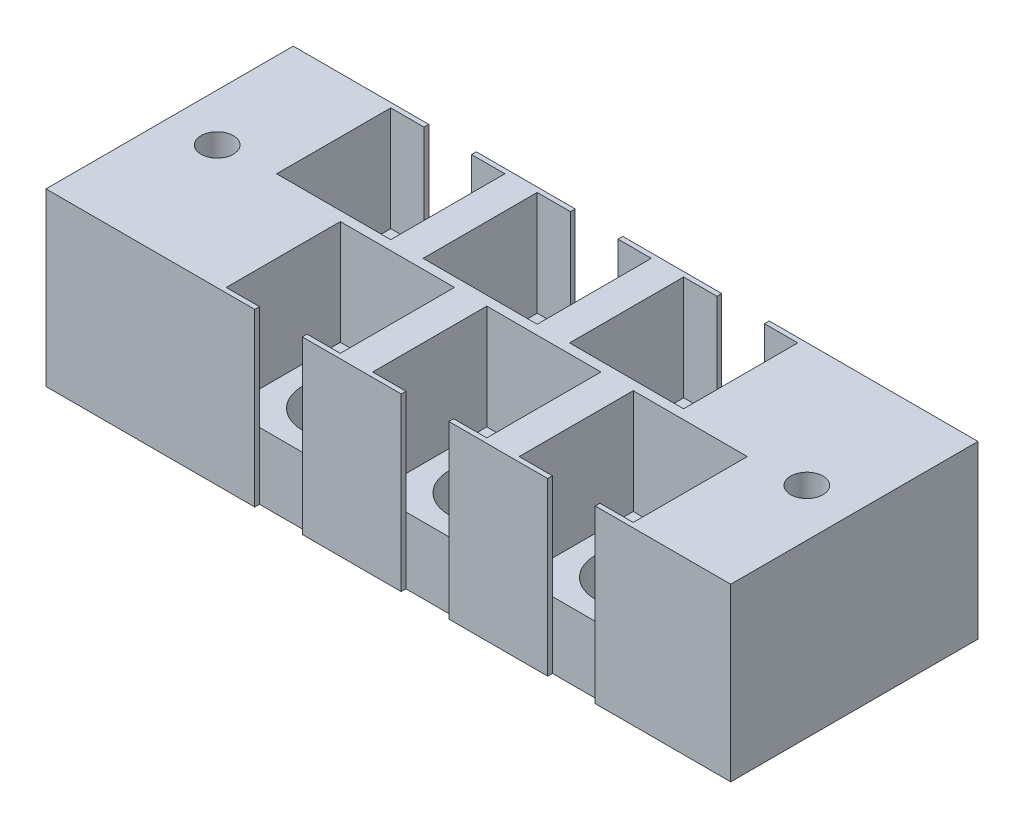
from build123d import *

# Parameters (mm, degrees)
SKETCH1_R               = 4
BOSS_EXTRUDE1_DEPTH     = 7
BOSS_EXTRUDE1_2_DEPTH   = 7
BOSS_EXTRUDE1_3_DEPTH   = 7
BOSS_EXTRUDE1_4_DEPTH   = 7
BOSS_EXTRUDE1_5_DEPTH   = 7
BOSS_EXTRUDE1_6_DEPTH   = 7
BOSS_EXTRUDE2_OUTLINE_R = 1.700000005
BOSS_EXTRUDE2_DEPTH     = 18
SKETCH2_W               = 2.2
SKETCH2_H               = 5.00000001
BOSS_EXTRUDE3_DEPTH     = 6
CUT_EXTRUDE1_DEPTH      = 1


# Read off the part's stored shape, not the designer's step: Boss-Extrude2
with BuildPart() as part:
    # Sketch1 → Boss-Extrude1 (new body)
    with BuildSketch(Plane(origin=(0, 0, 0), x_dir=(1, 0, 0), z_dir=(0, 1, 0))):
        Polygon((3.686387934, -16.664883738), (3.686388262, -4.664883738), (-8.313611738, -4.66488341), (-8.313612066, -16.66488341), align=None)
        with Locations(Location((-2.313611902, -10.664883574, 0), (0, 0, 270))):
            Circle(SKETCH1_R, mode=Mode.SUBTRACT)
    extrude(amount=BOSS_EXTRUDE1_DEPTH)



with BuildPart() as body_2:
    # Sketch1 → Boss-Extrude1 2 (new body)
    with BuildSketch(Plane(origin=(0, 0, 0), x_dir=(1, 0, 0), z_dir=(0, 1, 0))):
        Polygon((19.086387939, -16.664884095), (19.086388267, -4.664884095), (7.086388267, -4.664883767), (7.086387939, -16.664883767), align=None)
        with Locations(Location((13.086388103, -10.664883931, 0), (0, 0, 270))):
            Circle(SKETCH1_R, mode=Mode.SUBTRACT)
    extrude(amount=BOSS_EXTRUDE1_2_DEPTH)


with BuildPart() as body_3:
    # Sketch1 → Boss-Extrude1 3 (new body)
    with BuildSketch(Plane(origin=(0, 0, 0), x_dir=(1, 0, 0), z_dir=(0, 1, 0))):
        Polygon((34.486387949, -16.66488445), (34.486388277, -4.66488445), (22.486388277, -4.664884122), (22.486387949, -16.664884122), align=None)
        with Locations(Location((28.486388113, -10.664884286, 0), (0, 0, 270))):
            Circle(SKETCH1_R, mode=Mode.SUBTRACT)
    extrude(amount=BOSS_EXTRUDE1_3_DEPTH)


with BuildPart() as body_4:
    # Sketch1 → Boss-Extrude1 4 (new body)
    with BuildSketch(Plane(origin=(0, 0, 0), x_dir=(1, 0, 0), z_dir=(0, 1, 0))):
        Polygon((14.786387887, -17.664883977), (14.786387559, -29.664883977), (26.786387559, -29.664884305), (26.786387887, -17.664884305), align=None)
        with Locations(Location((20.786387723, -23.664884141, 0), (0, 0, 270))):
            Circle(SKETCH1_R, mode=Mode.SUBTRACT)
    extrude(amount=BOSS_EXTRUDE1_4_DEPTH)


with BuildPart() as body_5:
    # Sketch1 → Boss-Extrude1 5 (new body)
    with BuildSketch(Plane(origin=(0, 0, 0), x_dir=(1, 0, 0), z_dir=(0, 1, 0))):
        Polygon((30.186386338, -17.664884333), (30.18638601, -29.664884333), (42.18638601, -29.664884661), (42.186386338, -17.664884661), align=None)
        with Locations(Location((36.186386174, -23.664884497, 0), (0, 0, 270))):
            Circle(SKETCH1_R, mode=Mode.SUBTRACT)
    extrude(amount=BOSS_EXTRUDE1_5_DEPTH)


with BuildPart() as body_6:
    # Sketch1 → Boss-Extrude1 6 (new body)
    with BuildSketch(Plane(origin=(0, 0, 0), x_dir=(1, 0, 0), z_dir=(0, 1, 0))):
        Polygon((-0.613612103, -17.664883618), (-0.613612431, -29.664883618), (11.386387569, -29.664883947), (11.386387897, -17.664883947), align=None)
        with Locations(Location((5.386387733, -23.664883782, 0), (0, 0, 270))):
            Circle(SKETCH1_R, mode=Mode.SUBTRACT)
    extrude(amount=BOSS_EXTRUDE1_6_DEPTH)


with BuildPart() as part_1:
    add(part.part)

    add(body_2.part)  # Boss-Extrude2 merges body 2

    add(body_3.part)  # Boss-Extrude2 merges body 3

    add(body_4.part)  # Boss-Extrude2 merges body 4

    add(body_5.part)  # Boss-Extrude2 merges body 5

    add(body_6.part)  # Boss-Extrude2 merges body 6
    # Boss-Extrude2 outline → Boss-Extrude2 (add)
    with BuildSketch(Plane(origin=(0, 0, 0), x_dir=(1, 0, 0), z_dir=(0, 1, 0))):
        Polygon((10.586388267, -4.664883862), (10.586388281, -4.164883862), (0.186388276, -4.164883578), (0.186388262, -4.664883642), (3.686388262, -4.664883738), (3.686387934, -16.664883738), (-8.313612066, -16.66488341), (-8.313611738, -4.66488341), (-4.813611731, -4.664883505), (-4.813611724, -4.164883505), (-19.06361173, -4.164883116), (-19.06361244, -30.164883114), (2.886387555, -30.164883714), (2.886387569, -29.664883714), (-0.613612431, -29.664883618), (-0.613612103, -17.664883618), (11.386387897, -17.664883947), (11.386387569, -29.664883947), (7.886387562, -29.664883851), (7.886387555, -30.164883851), (18.286387545, -30.164884073), (18.286387559, -29.664884073), (14.786387559, -29.664883977), (14.786387887, -17.664883977), (26.786387887, -17.664884305), (26.786387559, -29.664884305), (23.286387552, -29.66488421), (23.286387545, -30.16488421), (33.686385997, -30.164884494), (33.68638601, -29.664884428), (30.18638601, -29.664884333), (30.186386338, -17.664884333), (42.186386338, -17.664884661), (42.18638601, -29.664884661), (38.686386004, -29.664884565), (38.686385997, -30.164884565), (52.93638756, -30.164884954), (52.93638827, -4.164885084), (30.986388291, -4.164884354), (30.986388277, -4.664884354), (34.486388277, -4.66488445), (34.486387949, -16.66488445), (22.486387949, -16.664884122), (22.486388277, -4.664884122), (25.986388284, -4.664884218), (25.986388291, -4.164884218), (15.586388281, -4.164884108), (15.586388267, -4.664883999), (19.086388267, -4.664884095), (19.086387939, -16.664884095), (7.086387939, -16.664883767), (7.086388267, -4.664883767), align=None)
        with Locations((47.936387915, -17.164884883)):
            Circle(BOSS_EXTRUDE2_OUTLINE_R, mode=Mode.SUBTRACT)
        with Locations((-14.063612085, -17.164883252)):
            Circle(BOSS_EXTRUDE2_OUTLINE_R, mode=Mode.SUBTRACT)
    extrude(amount=BOSS_EXTRUDE2_DEPTH)

    # Sketch2 → Boss-Extrude3 (add)
    with BuildSketch(Plane.XZ):
        Polygon((10.586387955, 19.664883873), (10.586388061, 14.664883862), (8.386388061, 14.664883816), (8.386387955, 19.664883826), align=None)
        Polygon((25.986387967, 19.664884228), (25.986388072, 14.664884218), (23.786388072, 14.664884171), (23.786387967, 19.664884182), align=None)
        Polygon((33.186387781, 19.664884438), (33.186387947, 14.664884428), (30.986387947, 14.664884354), (30.986387781, 19.664884365), align=None)
        Polygon((17.786387957, 19.664884055), (17.786388062, 14.664884045), (15.586388062, 14.664883999), (15.586387957, 19.664884009), align=None)
        with Locations((1.286388276, 17.164883628)):
            Rectangle(SKETCH2_W, SKETCH2_H)
    extrude(amount=BOSS_EXTRUDE3_DEPTH)

    # Sketch3 → Cut-Extrude1 (cut)
    # profile 1 of 2: a face of its own
    with BuildSketch(Plane.XZ):
        Polygon((-8.682133254, 26.826855078), (-7.135338382, 26.826855078), (-7.135338382, 26.501214052), (-8.397197357, 26.501214052), (-8.397197357, 25.524290975), (-7.135338382, 25.524290975), (-7.135338382, 25.198649949), (-8.397197357, 25.198649949), (-8.397197357, 23.651855078), (-8.682133254, 23.651855078), align=None)
    # profile 2 of 2: a face of its own
    with BuildSketch(Plane.XZ):
        Polygon((-5.117254448, 26.908265334), (-5.059376844, 26.908265334), (-5.059376844, 24.710188411), (-4.69303069, 24.710188411), (-4.69303069, 24.384547385), (-5.059376844, 24.384547385), (-5.059376844, 23.651855078), (-5.344312741, 23.651855078), (-5.344312741, 24.384547385), (-6.850402485, 24.384547385), align=None)
        Polygon((-5.344312741, 24.710188411), (-5.344312741, 26.087802594), (-6.290070954, 24.710188411), align=None, mode=Mode.SUBTRACT)
    extrude(amount=-CUT_EXTRUDE1_DEPTH, mode=Mode.SUBTRACT)


solid = part_1.part
